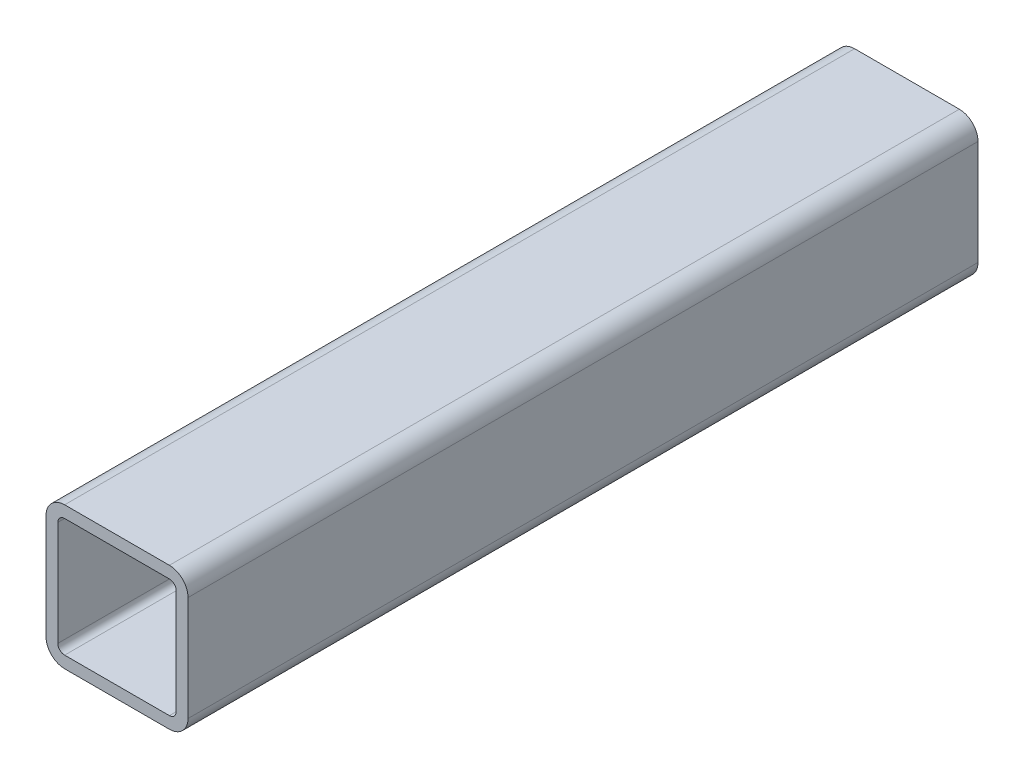
from build123d import *

# Parameters (mm, degrees)
BOSS_EXTRUDE1_DEPTH = 211.9


with BuildPart() as part:
    # Sketch1 → Boss-Extrude1 (new body)
    with BuildSketch(Plane.XY):
        with BuildLine():
            Line((-14.05, 19.05), (14.05, 19.05))
            ThreePointArc((14.05, 19.05), (17.585533906, 17.585533906), (19.05, 14.05))
            Line((19.05, 14.05), (19.05, -14.05))
            ThreePointArc((19.05, -14.05), (17.585533906, -17.585533906), (14.05, -19.05))
            Line((14.05, -19.05), (-14.05, -19.05))
            ThreePointArc((-14.05, -19.05), (-17.585533906, -17.585533906), (-19.05, -14.05))
            Line((-19.05, -14.05), (-19.05, 14.05))
            ThreePointArc((-19.05, 14.05), (-17.585533906, 17.585533906), (-14.05, 19.05))
        make_face()
        with BuildLine():
            Line((-15.875, 14.05), (-15.875, -14.05))
            ThreePointArc((-15.875, -14.05), (-15.340469876, -15.340469876), (-14.05, -15.875))
            Line((-14.05, -15.875), (14.05, -15.875))
            ThreePointArc((14.05, -15.875), (15.340469876, -15.340469876), (15.875, -14.05))
            Line((15.875, -14.05), (15.875, 14.05))
            ThreePointArc((15.875, 14.05), (15.340469876, 15.340469876), (14.05, 15.875))
            Line((14.05, 15.875), (-14.05, 15.875))
            ThreePointArc((-14.05, 15.875), (-15.340469876, 15.340469876), (-15.875, 14.05))
        make_face(mode=Mode.SUBTRACT)
    extrude(amount=BOSS_EXTRUDE1_DEPTH)


solid = part.part
